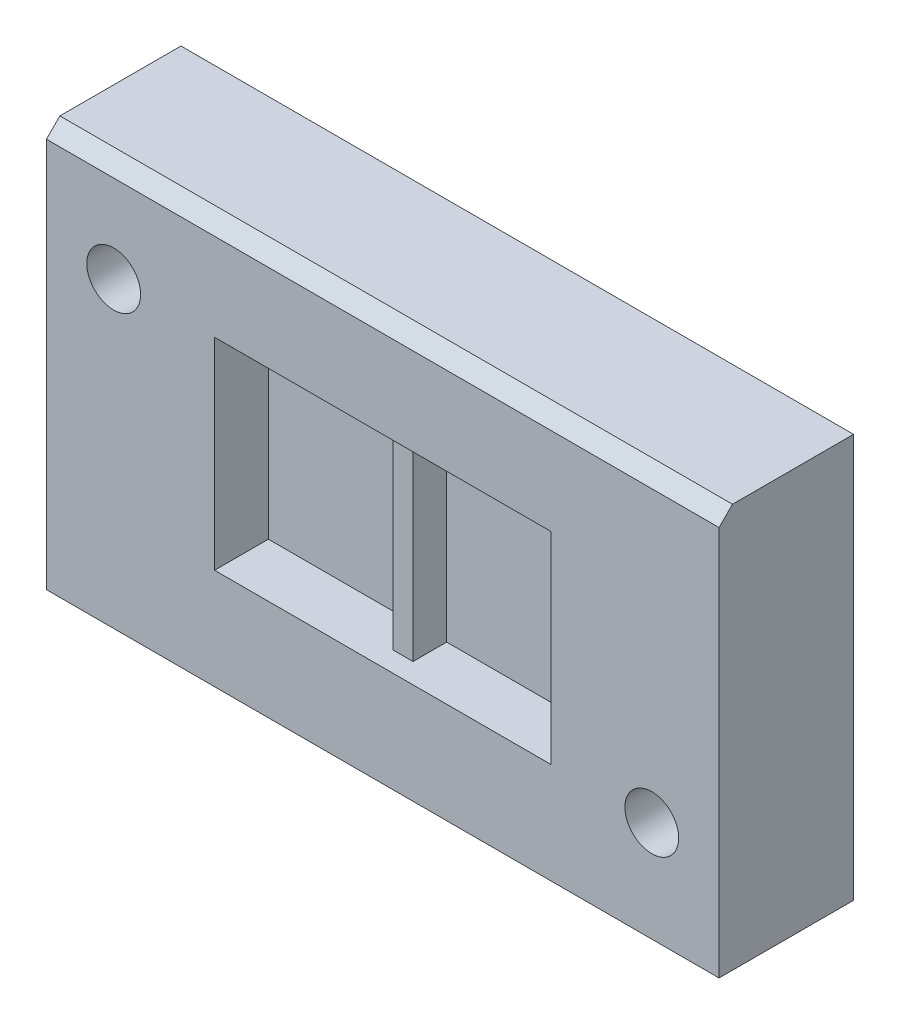
from build123d import *

# Parameters (mm, degrees)
SKIZZE1_W                       = 100
SKIZZE1_H                       = 60
AUFSATZ_LINEAR_AUSTRAGEN1_DEPTH = 20
SKIZZE2_W                       = 50
SKIZZE2_H                       = 30
SCHNITT_LINEAR_AUSTRAGEN1_DEPTH = 8
SKIZZE3_R                       = 4
SCHNITT_LINEAR_AUSTRAGEN2_DEPTH = 62.64414003
SKIZZE4_R                       = 4
SCHNITT_LINEAR_AUSTRAGEN3_DEPTH = 62.64414003
VERST_RKUNGSRIPPE1_REACH        = 63.644
SKIZZE5_WALL_W                  = 145.28828006
SKIZZE5_WALL_H                  = 3
FASE1_SIZE                      = 2


with BuildPart() as part:
    # Skizze1 → Aufsatz-Linear austragen1 (new body)
    with BuildSketch(Plane.XY):
        Rectangle(SKIZZE1_W, SKIZZE1_H)
    extrude(amount=AUFSATZ_LINEAR_AUSTRAGEN1_DEPTH)

    # Skizze2 → Schnitt-Linear austragen1 (cut)
    with BuildSketch(Plane.XY.offset(20)):
        Rectangle(SKIZZE2_W, SKIZZE2_H)
    extrude(amount=-SCHNITT_LINEAR_AUSTRAGEN1_DEPTH, mode=Mode.SUBTRACT)

    # Skizze3 → Schnitt-Linear austragen2 (cut, through all)
    with BuildSketch(Plane.XY.offset(20)):
        with Locations((-40, 15)):
            Circle(SKIZZE3_R)
    extrude(amount=-SCHNITT_LINEAR_AUSTRAGEN2_DEPTH, mode=Mode.SUBTRACT)

    # Skizze4 → Schnitt-Linear austragen3 (cut, through all)
    with BuildSketch(Plane.XY.offset(20)):
        with Locations((40, -15)):
            Circle(SKIZZE4_R)
    extrude(amount=-SCHNITT_LINEAR_AUSTRAGEN3_DEPTH, mode=Mode.SUBTRACT)

    # Skizze5 wall → Verstärkungsrippe1 (add, up to next)
    with BuildSketch(Plane(origin=(0, 0, 17), x_dir=(0, 1, 0), z_dir=(0, 0, 1)), mode=Mode.PRIVATE) as verst_rkungsrippe1_sk1:
        Rectangle(SKIZZE5_WALL_W, SKIZZE5_WALL_H)
    verst_rkungsrippe1_tool1 = extrude(verst_rkungsrippe1_sk1.sketch, amount=-VERST_RKUNGSRIPPE1_REACH, mode=Mode.PRIVATE) - part.part
    add(verst_rkungsrippe1_tool1.solids().sort_by_distance((0, 0, 17))[0])

    # Fase1
    fase1_edges = [part.edges().sort_by_distance(p)[0] for p in [
        (0, 30, 20),
    ]]
    chamfer(fase1_edges, length=FASE1_SIZE)


solid = part.part
